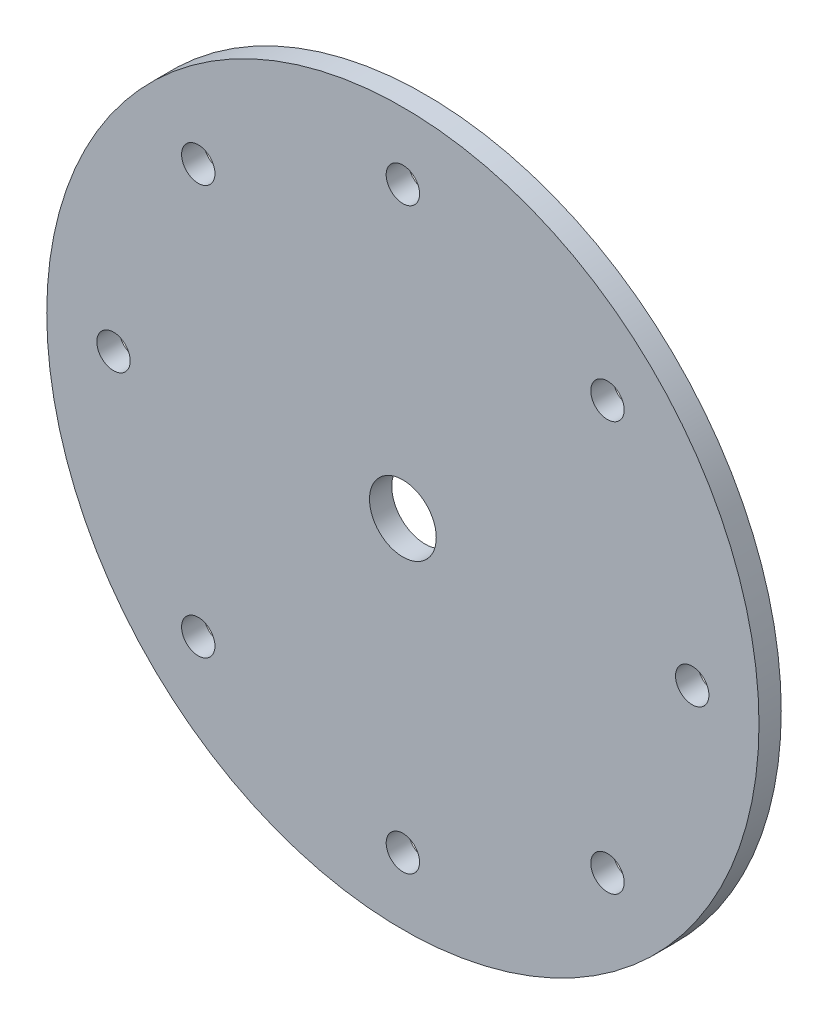
from build123d import *

# Parameters (mm, degrees)
SKETCH1_R        = 101.6
SKETCH1_R_2      = 4.7625
SKETCH1_R_3      = 9.525
ROTOR_DISC_DEPTH = 6.35


with BuildPart() as part:
    # Sketch1 → Rotor Disc (new body)
    with BuildSketch(Plane.XY):
        Circle(SKETCH1_R)
        with Locations((-58.371664787, -58.371664787)):
            Circle(SKETCH1_R_2, mode=Mode.SUBTRACT)
        with Locations((-82.55, 0)):
            Circle(SKETCH1_R_2, mode=Mode.SUBTRACT)
        Circle(SKETCH1_R_3, mode=Mode.SUBTRACT)
        with Locations((0, -82.55)):
            Circle(SKETCH1_R_2, mode=Mode.SUBTRACT)
        with Locations((58.371664787, -58.371664787)):
            Circle(SKETCH1_R_2, mode=Mode.SUBTRACT)
        with Locations((-58.371664787, 58.371664787)):
            Circle(SKETCH1_R_2, mode=Mode.SUBTRACT)
        with Locations((0, 82.55)):
            Circle(SKETCH1_R_2, mode=Mode.SUBTRACT)
        with Locations((82.55, 0)):
            Circle(SKETCH1_R_2, mode=Mode.SUBTRACT)
        with Locations((58.371664787, 58.371664787)):
            Circle(SKETCH1_R_2, mode=Mode.SUBTRACT)
    extrude(amount=ROTOR_DISC_DEPTH)


solid = part.part
